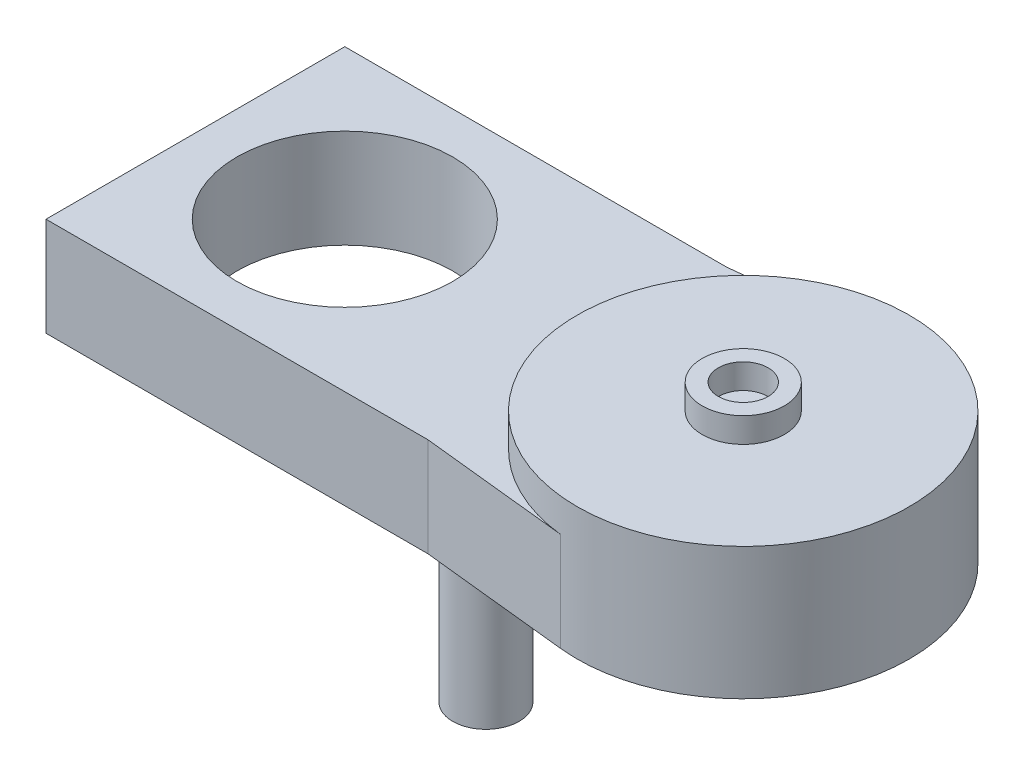
from build123d import *

# Parameters (mm, degrees)
BOSS_EXTRUDE2_OUTLINE_R = 6.5
BOSS_EXTRUDE2_DEPTH     = 5.95
SKETCH3_R               = 10
BOSS_EXTRUDE3_DEPTH     = 2
SKETCH4_R               = 2
BOSS_EXTRUDE4_DEPTH     = 10
SKETCH5_R               = 2.475
SKETCH5_R_2             = 1.5
BOSS_EXTRUDE5_DEPTH     = 1.5


# Read off the part's stored shape, not the designer's step: Boss-Extrude2
with BuildPart() as part:
    # Boss-Extrude2 outline → Boss-Extrude2 (new body)
    with BuildSketch(Plane(origin=(0, 0, 0), x_dir=(1, 0, 0), z_dir=(0, 1, 0))):
        with BuildLine():
            Line((14, 9), (-9, 9))
            Line((-9, 9), (-9, -9))
            Line((-9, -9), (14, -9))
            Line((14, -9), (22.950276243, -9.944751381))
            ThreePointArc((22.950276243, -9.944751381), (34, 0), (22.950276243, 9.944751381))
            Line((22.950276243, 9.944751381), (14, 9))
        make_face()
        Circle(BOSS_EXTRUDE2_OUTLINE_R, mode=Mode.SUBTRACT)
    extrude(amount=BOSS_EXTRUDE2_DEPTH)

    # Sketch3 → Boss-Extrude3 (add)
    with BuildSketch(Plane(origin=(0, 5.95, 0), x_dir=(1, 0, 0), z_dir=(0, 1, 0))):
        with Locations(Location((24, 0, 0), (0, 0, 96.025575008))):
            Circle(SKETCH3_R)
    extrude(amount=BOSS_EXTRUDE3_DEPTH)

    # Sketch4 → Boss-Extrude4 (add)
    with BuildSketch(Plane.XZ):
        with Locations(Location((13.5, 5, 0), (0, 0, 90))):
            Circle(SKETCH4_R)
        with Locations(Location((13.5, -5, 0), (0, 0, 90))):
            Circle(SKETCH4_R)
    extrude(amount=BOSS_EXTRUDE4_DEPTH)

    # Sketch5 → Boss-Extrude5 (add)
    with BuildSketch(Plane(origin=(0, 7.95, 0), x_dir=(1, 0, 0), z_dir=(0, 1, 0))):
        with Locations(Location((24, 0, 0), (0, 0, 270))):
            Circle(SKETCH5_R)
        with Locations(Location((24, 0, 0), (0, 0, 270))):
            Circle(SKETCH5_R_2, mode=Mode.SUBTRACT)
    extrude(amount=BOSS_EXTRUDE5_DEPTH)


solid = part.part
